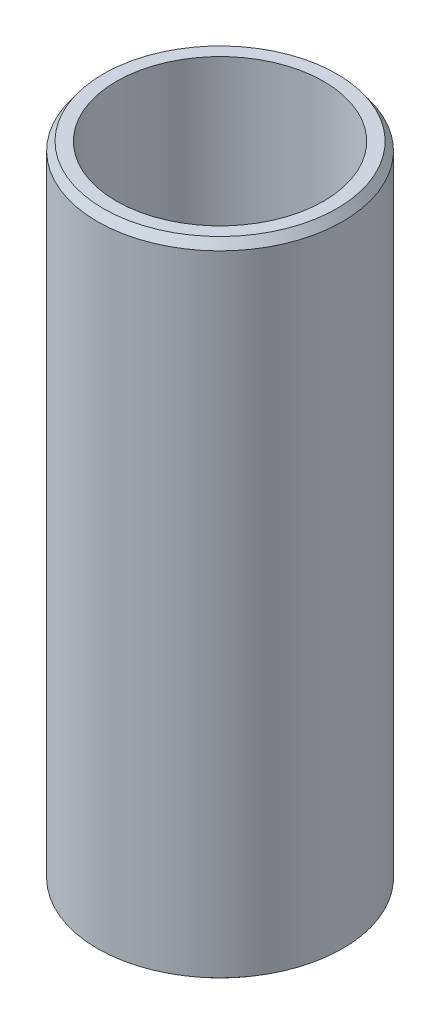
from build123d import *
from OCP.BRepFilletAPI import BRepFilletAPI_MakeChamfer

# Parameters (mm, degrees)
SKETCH1_R           = 57.5
BOSS_EXTRUDE1_DEPTH = 301.835364918
SKETCH2_R           = 48.631687864
CUT_EXTRUDE1_DEPTH  = 313.597324869
CHAMFER1_SIZE       = 3.875388452
CHAMFER1_SIZE2      = 2.777062666


with BuildPart() as part:
    # Sketch1 → Boss-Extrude1 (new body)
    with BuildSketch(Plane(origin=(0, 0, 0), x_dir=(1, 0, 0), z_dir=(0, 1, 0))):
        Circle(SKETCH1_R)
    extrude(amount=BOSS_EXTRUDE1_DEPTH)

    # Sketch2 → Cut-Extrude1 (cut, through all)
    with BuildSketch(Plane(origin=(0, 0, 0), x_dir=(1, 0, 0), z_dir=(0, 1, 0))):
        Circle(SKETCH2_R)
    extrude(amount=CUT_EXTRUDE1_DEPTH, mode=Mode.SUBTRACT)

    # Chamfer1: one chamfer whose edges measure the first distance from different faces: ONE call of the kernel's chamfer builder (chamfer() names one face for all edges)
    chamfer1_edges_1 = [part.edges().sort_by_distance(p)[0] for p in [
        (-57.5, 301.835364918, 0),
    ]]
    chamfer1_side_1 = [part.faces().sort_by_distance(p)[0] for p in [
        (-57.5, 150.917682459, 0),
    ]]
    chamfer1_edges_2 = [part.edges().sort_by_distance(p)[0] for p in [
        (-57.5, 0, 0),
    ]]
    chamfer1_side_2 = [part.faces().sort_by_distance(p)[0] for p in [
        (-55.873654403, 0, 0),
    ]]
    chamfer1 = BRepFilletAPI_MakeChamfer(part.part.solid().wrapped)
    for e in chamfer1_edges_1:
        chamfer1.Add(CHAMFER1_SIZE, CHAMFER1_SIZE2, e.wrapped, chamfer1_side_1[0].wrapped)  # the first distance lies on this face
    for e in chamfer1_edges_2:
        chamfer1.Add(CHAMFER1_SIZE, CHAMFER1_SIZE2, e.wrapped, chamfer1_side_2[0].wrapped)  # the first distance lies on this face
    add(Compound.cast(chamfer1.Shape()), mode=Mode.REPLACE)


solid = part.part
